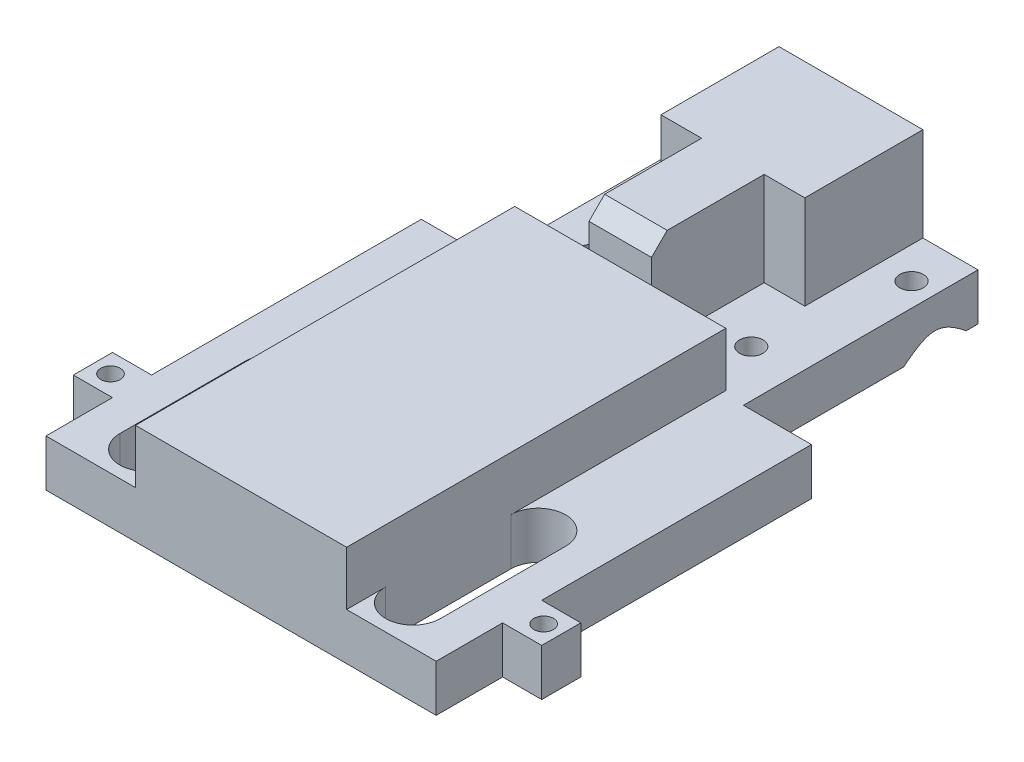
from build123d import *

# Parameters (mm, degrees)
EXTRUDE_1_DEPTH     = 6
EXTRUDE_2_DEPTH     = 12
CUT_EXTRUDE_1_REACH = 52.712
SKETCH_3_R          = 1.5
CHAMFER_1_SIZE      = 2
SKETCH_4_W          = 27
SKETCH_4_H          = 48.5
EXTRUDE_3_DEPTH     = 6.9
SKETCH_5_W          = 32.5
SKETCH_5_H          = 0.5
CUT_EXTRUDE_2_DEPTH = 51.711956184
SKETCH_6_W          = 5
SKETCH_6_H          = 5
EXTRUDE_4_DEPTH     = 6
SKETCH_9_R          = 1.25
CUT_EXTRUDE_5_DEPTH = 54.113110434
SKETCH_10_R         = 2
CUT_EXTRUDE_6_DEPTH = 4
CHAMFER_3_SIZE      = 3.5


with BuildPart() as part:
    # 草图1 → 凸台-拉伸1 (new body)
    with BuildSketch(Plane(origin=(0, 0, 0), x_dir=(1, 0, 0), z_dir=(0, 1, 0))):
        Polygon((-25.45, -32), (-25.45, -28), (-25.45, -3.5), (-25.45, 0.5), (-25.45, 8.5), (-16.25, 8.5), (-16.25, 38.5), (16.25, 38.5), (16.25, 8.5), (25.45, 8.5), (25.45, 0.5), (25.45, -3.5), (25.45, -28), (25.45, -32), (25.45, -40), (-25.45, -40), align=None)
    extrude(amount=EXTRUDE_1_DEPTH)

    # 草图2 → 凸台-拉伸2 (add)
    with BuildSketch(Plane(origin=(0, 6, 0), x_dir=(1, 0, 0), z_dir=(0, 1, 0))):
        Polygon((-4, 22.9), (-4, 8.5), (4, 8.5), (4, 22.9), (9.2, 22.9), (9.2, 38.5), (-9.2, 38.5), (-9.2, 22.9), align=None)
    extrude(amount=EXTRUDE_2_DEPTH)

    # 草图3 → 切除-拉伸1 (cut, up to next)
    with BuildSketch(Plane.XZ, mode=Mode.PRIVATE) as cut_extrude_1_sk1:
        with Locations(Location((13.25, -32.5, 0), (0, 0, 270))):
            Circle(SKETCH_3_R)
    cut_extrude_1_tool1 = extrude(cut_extrude_1_sk1.sketch, amount=-CUT_EXTRUDE_1_REACH, mode=Mode.PRIVATE) & part.part
    # 草图3 → 切除-拉伸1 (cut, up to next)
    with BuildSketch(Plane.XZ, mode=Mode.PRIVATE) as cut_extrude_1_sk2:
        with Locations(Location((10.25, -15, 0), (0, 0, 270))):
            Circle(SKETCH_3_R)
    cut_extrude_1_tool2 = extrude(cut_extrude_1_sk2.sketch, amount=-CUT_EXTRUDE_1_REACH, mode=Mode.PRIVATE) & part.part
    # 草图3 → 切除-拉伸1 (cut, up to next)
    with BuildSketch(Plane.XZ, mode=Mode.PRIVATE) as cut_extrude_1_sk3:
        with Locations(Location((-13.25, -32.5, 0), (0, 0, 90))):
            Circle(SKETCH_3_R)
    cut_extrude_1_tool3 = extrude(cut_extrude_1_sk3.sketch, amount=-CUT_EXTRUDE_1_REACH, mode=Mode.PRIVATE) & part.part
    # 草图3 → 切除-拉伸1 (cut, up to next)
    with BuildSketch(Plane.XZ, mode=Mode.PRIVATE) as cut_extrude_1_sk4:
        with Locations(Location((-10.25, -15, 0), (0, 0, 90))):
            Circle(SKETCH_3_R)
    cut_extrude_1_tool4 = extrude(cut_extrude_1_sk4.sketch, amount=-CUT_EXTRUDE_1_REACH, mode=Mode.PRIVATE) & part.part
    # 草图3 → 切除-拉伸1 (cut, up to next)
    with BuildSketch(Plane.XZ, mode=Mode.PRIVATE) as cut_extrude_1_sk5:
        with BuildLine():
            Line((13.5, 19), (13.5, 35))
            ThreePointArc((13.5, 35), (17, 38.5), (20.5, 35))
            Line((20.5, 35), (20.5, 19))
            ThreePointArc((20.5, 19), (17, 15.5), (13.5, 19))
        make_face()
    cut_extrude_1_tool5 = extrude(cut_extrude_1_sk5.sketch, amount=-CUT_EXTRUDE_1_REACH, mode=Mode.PRIVATE) & part.part
    # 草图3 → 切除-拉伸1 (cut, up to next)
    with BuildSketch(Plane.XZ, mode=Mode.PRIVATE) as cut_extrude_1_sk6:
        with BuildLine():
            Line((-13.5, 19), (-13.5, 35))
            ThreePointArc((-13.5, 35), (-17, 38.5), (-20.5, 35))
            Line((-20.5, 35), (-20.5, 19))
            ThreePointArc((-20.5, 19), (-17, 15.5), (-13.5, 19))
        make_face()
    cut_extrude_1_tool6 = extrude(cut_extrude_1_sk6.sketch, amount=-CUT_EXTRUDE_1_REACH, mode=Mode.PRIVATE) & part.part
    add(cut_extrude_1_tool1.solids().sort_by_distance((13.25, 0, -32.5))[0], mode=Mode.SUBTRACT)
    add(cut_extrude_1_tool2.solids().sort_by_distance((10.25, 0, -15))[0], mode=Mode.SUBTRACT)
    add(cut_extrude_1_tool3.solids().sort_by_distance((-13.25, 0, -32.5))[0], mode=Mode.SUBTRACT)
    add(cut_extrude_1_tool4.solids().sort_by_distance((-10.25, 0, -15))[0], mode=Mode.SUBTRACT)
    add(cut_extrude_1_tool5.solids().sort_by_distance((17, 0, 27))[0], mode=Mode.SUBTRACT)
    add(cut_extrude_1_tool6.solids().sort_by_distance((-17, 0, 27))[0], mode=Mode.SUBTRACT)

    # 倒角1
    chamfer_1_edges = [part.edges().sort_by_distance(p)[0] for p in [
        (0, 18, -8.5),
    ]]
    chamfer(chamfer_1_edges, length=CHAMFER_1_SIZE)

    # 草图4 → 凸台-拉伸3 (add)
    with BuildSketch(Plane(origin=(0, 6, 0), x_dir=(1, 0, 0), z_dir=(0, 1, 0))):
        with Locations((0, -15.75)):
            Rectangle(SKETCH_4_W, SKETCH_4_H)
    extrude(amount=EXTRUDE_3_DEPTH)

    # 草图5 → 切除-拉伸2 (cut, through all)
    with BuildSketch(Plane.XZ):
        Polygon((24.95, 40), (24.95, -8), (16.25, -8), (16.25, -8.5), (25.45, -8.5), (25.45, 40), align=None)
        Polygon((-16.25, -8.5), (-25.45, -8.5), (-25.45, 40), (-24.95, 40), (-24.95, -8), (-16.25, -8), align=None)
        with Locations((0, -38.25)):
            Rectangle(SKETCH_5_W, SKETCH_5_H)
    extrude(amount=-CUT_EXTRUDE_2_DEPTH, mode=Mode.SUBTRACT)

    # 草图6 → 凸台-拉伸4 (add)
    with BuildSketch(Plane.XZ):
        with Locations((-27.45, 29)):
            Rectangle(SKETCH_6_W, SKETCH_6_H)
        with Locations((27.45, 29)):
            Rectangle(SKETCH_6_W, SKETCH_6_H)
    extrude(amount=-EXTRUDE_4_DEPTH)

    # 草图9 → 切除-拉伸5 (cut, through all)
    with BuildSketch(Plane.XZ):
        with Locations(Location((-27.7, 29, 0), (0, 0, 270))):
            Circle(SKETCH_9_R)
        with Locations(Location((27.7, 29, 0), (0, 0, 270))):
            Circle(SKETCH_9_R)
    extrude(amount=-CUT_EXTRUDE_5_DEPTH, mode=Mode.SUBTRACT)

    # 草图10 → 切除-拉伸6 (cut)
    with BuildSketch(Plane.XZ):
        with Locations(Location((27.7, 29, 0), (0, 0, 270))):
            Circle(SKETCH_10_R)
        with Locations(Location((-27.7, 29, 0), (0, 0, 270))):
            Circle(SKETCH_10_R)
    extrude(amount=-CUT_EXTRUDE_6_DEPTH, mode=Mode.SUBTRACT)

    # 倒角3
    # the kernel refuses this chamfer: 3.5 mm, written as the material it takes off along each edge
    with BuildSketch(Plane(origin=(10.25, 0, -15), x_dir=(0, 0, -1), z_dir=(-1, 0, 0))) as chamfer_3_piece_1:
        Polygon((1.5 + CHAMFER_3_SIZE, 0), (1.5, -CHAMFER_3_SIZE), (1.5, 0), align=None)
    revolve(axis=Axis((10.25, 0, -15), (0, -1, 0)), mode=Mode.SUBTRACT)
    with BuildSketch(Plane(origin=(-13.25, 0, -32.5), x_dir=(0, 0, 1), z_dir=(1, 0, 0))) as chamfer_3_piece_2:
        Polygon((1.5, -CHAMFER_3_SIZE), (1.5 + CHAMFER_3_SIZE, 0), (1.5, 0), align=None)
    revolve(axis=Axis((-13.25, 0, -32.5), (0, -1, 0)), mode=Mode.SUBTRACT)
    with BuildSketch(Plane(origin=(13.25, 0, -32.5), x_dir=(0, 0, -1), z_dir=(-1, 0, 0))) as chamfer_3_piece_3:
        Polygon((1.5 + CHAMFER_3_SIZE, 0), (1.5, -CHAMFER_3_SIZE), (1.5, 0), align=None)
    revolve(axis=Axis((13.25, 0, -32.5), (0, -1, 0)), mode=Mode.SUBTRACT)
    with BuildSketch(Plane(origin=(-10.25, 0, -15), x_dir=(0, 0, 1), z_dir=(1, 0, 0))) as chamfer_3_piece_4:
        Polygon((1.5, -CHAMFER_3_SIZE), (1.5 + CHAMFER_3_SIZE, 0), (1.5, 0), align=None)
    revolve(axis=Axis((-10.25, 0, -15), (0, -1, 0)), mode=Mode.SUBTRACT)


solid = part.part
